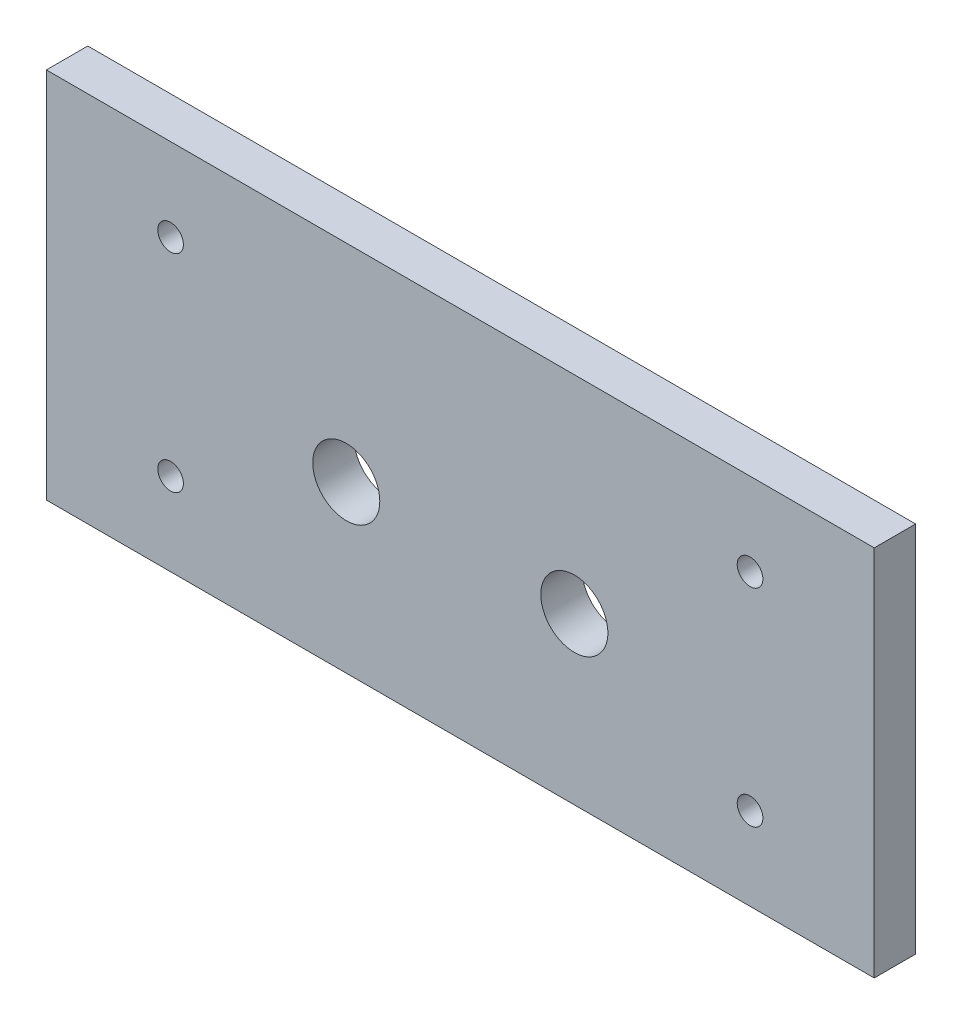
from build123d import *

# Parameters (mm, degrees)
ESQUISSE1_W        = 100
ESQUISSE1_H        = 45
ESQUISSE1_R        = 1.55
ESQUISSE1_R_2      = 4.05
BOSS_EXTRU_1_DEPTH = 5


with BuildPart() as part:
    # Esquisse1 → Boss.-Extru.1 (new body)
    with BuildSketch(Plane.XY):
        Rectangle(ESQUISSE1_W, ESQUISSE1_H)
        with Locations((-35, -12.5)):
            Circle(ESQUISSE1_R, mode=Mode.SUBTRACT)
        with Locations((-35, 12.5)):
            Circle(ESQUISSE1_R, mode=Mode.SUBTRACT)
        with Locations((35, -12.5)):
            Circle(ESQUISSE1_R, mode=Mode.SUBTRACT)
        with Locations((35, 12.5)):
            Circle(ESQUISSE1_R, mode=Mode.SUBTRACT)
        with Locations((-13.774977314, -2.5)):
            Circle(ESQUISSE1_R_2, mode=Mode.SUBTRACT)
        with Locations((13.774977314, -2.5)):
            Circle(ESQUISSE1_R_2, mode=Mode.SUBTRACT)
    extrude(amount=-BOSS_EXTRU_1_DEPTH)


solid = part.part
